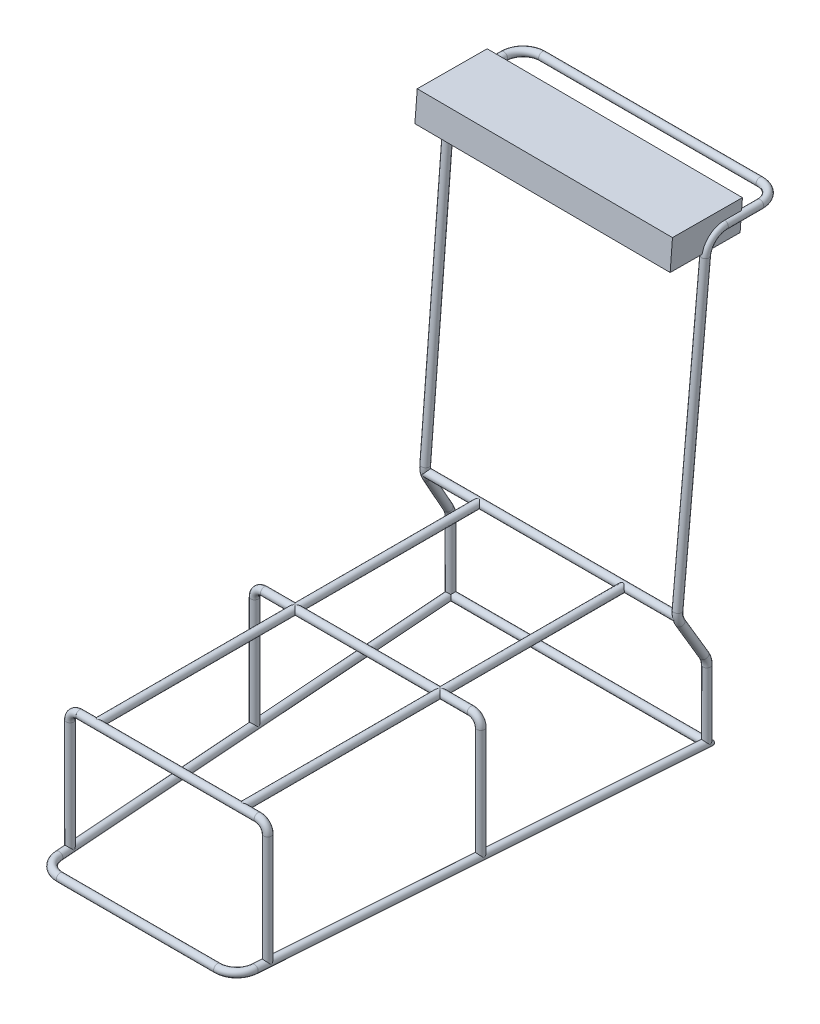
from build123d import *

# Parameters (mm, degrees)
SKETCH1_R                              = 7.9
SKETCH1_R_2                            = 6.7
PIPE_CONFIGURED_21_3_X_2_3_1_DEPTH     = 325.510463728
SKETCH1_ON_SEGMENT_2_R                 = 7.9
SKETCH1_ON_SEGMENT_2_R_2               = 6.7
PIPE_CONFIGURED_21_3_X_2_3_1_2_ANGLE   = 85.91438322
SKETCH1_ON_SEGMENT_3_R                 = 7.9
SKETCH1_ON_SEGMENT_3_R_2               = 6.7
PIPE_CONFIGURED_21_3_X_2_3_1_3_DEPTH   = 888.072479084
SKETCH1_ON_SEGMENT_4_R                 = 7.9
SKETCH1_ON_SEGMENT_4_R_2               = 6.7
PIPE_CONFIGURED_21_3_X_2_3_1_4_DEPTH   = 555.99754425
SKETCH1_ON_SEGMENT_5_R                 = 7.9
SKETCH1_ON_SEGMENT_5_R_2               = 6.7
PIPE_CONFIGURED_21_3_X_2_3_1_5_DEPTH   = 888.072479084
SKETCH1_ON_SEGMENT_6_R                 = 7.9
SKETCH1_ON_SEGMENT_6_R_2               = 6.7
PIPE_CONFIGURED_21_3_X_2_3_1_6_ANGLE   = 85.91438322
SKETCH13_R                             = 7.9
SKETCH13_R_2                           = 6.7
PIPE_CONFIGURED_21_3_X_2_3_5_DEPTH     = 139.269057496
SKETCH13_ON_SEGMENT_2_R                = 7.9
SKETCH13_ON_SEGMENT_2_R_2              = 6.7
PIPE_CONFIGURED_21_3_X_2_3_5_2_ANGLE   = 30
SKETCH13_ON_SEGMENT_3_R                = 7.9
SKETCH13_ON_SEGMENT_3_R_2              = 6.7
PIPE_CONFIGURED_21_3_X_2_3_5_3_DEPTH   = 92.155116602
SKETCH13_ON_SEGMENT_4_R                = 7.9
SKETCH13_ON_SEGMENT_4_R_2              = 6.7
PIPE_CONFIGURED_21_3_X_2_3_5_4_ANGLE   = 35
SKETCH13_ON_SEGMENT_5_R                = 7.9
SKETCH13_ON_SEGMENT_5_R_2              = 6.7
PIPE_CONFIGURED_21_3_X_2_3_5_5_DEPTH   = 613.247713082
SKETCH13_ON_SEGMENT_6_R                = 7.9
SKETCH13_ON_SEGMENT_6_R_2              = 6.7
PIPE_CONFIGURED_21_3_X_2_3_5_6_ANGLE   = 85.012738731
SKETCH13_ON_SEGMENT_7_R                = 7.9
SKETCH13_ON_SEGMENT_7_R_2              = 6.7
PIPE_CONFIGURED_21_3_X_2_3_5_7_DEPTH   = 73.338571858
SKETCH13_ON_SEGMENT_8_R                = 7.9
SKETCH13_ON_SEGMENT_8_R_2              = 6.7
PIPE_CONFIGURED_21_3_X_2_3_5_8_ANGLE   = 90
SKETCH13_ON_SEGMENT_9_R                = 7.9
SKETCH13_ON_SEGMENT_9_R_2              = 6.7
PIPE_CONFIGURED_21_3_X_2_3_5_9_DEPTH   = 450
SKETCH13_ON_SEGMENT_10_R               = 7.9
SKETCH13_ON_SEGMENT_10_R_2             = 6.7
PIPE_CONFIGURED_21_3_X_2_3_5_10_ANGLE  = 90
SKETCH13_ON_SEGMENT_11_R               = 7.9
SKETCH13_ON_SEGMENT_11_R_2             = 6.7
PIPE_CONFIGURED_21_3_X_2_3_5_11_DEPTH  = 73.338571858
SKETCH13_ON_SEGMENT_12_R               = 7.9
SKETCH13_ON_SEGMENT_12_R_2             = 6.7
PIPE_CONFIGURED_21_3_X_2_3_5_12_ANGLE  = 85.012738731
SKETCH13_ON_SEGMENT_13_R               = 7.9
SKETCH13_ON_SEGMENT_13_R_2             = 6.7
PIPE_CONFIGURED_21_3_X_2_3_5_13_DEPTH  = 613.247713082
SKETCH13_ON_SEGMENT_14_R               = 7.9
SKETCH13_ON_SEGMENT_14_R_2             = 6.7
PIPE_CONFIGURED_21_3_X_2_3_5_14_ANGLE  = 35
SKETCH13_ON_SEGMENT_15_R               = 7.9
SKETCH13_ON_SEGMENT_15_R_2             = 6.7
PIPE_CONFIGURED_21_3_X_2_3_5_15_DEPTH  = 92.155116602
SKETCH13_ON_SEGMENT_16_R               = 7.9
SKETCH13_ON_SEGMENT_16_R_2             = 6.7
PIPE_CONFIGURED_21_3_X_2_3_5_16_ANGLE  = 30
SKETCH13_ON_SEGMENT_17_R               = 7.9
SKETCH13_ON_SEGMENT_17_R_2             = 6.7
PIPE_CONFIGURED_21_3_X_2_3_5_17_DEPTH  = 139.269057496
SKETCH114_ON_SEGMENT_1_R               = 7.9375
SKETCH114_ON_SEGMENT_1_R_2             = 6.4375
PIPE_CONFIGURED_21_3_X_2_3_44_DEPTH    = 230
SKETCH114_ON_SEGMENT_2_R               = 7.9375
SKETCH114_ON_SEGMENT_2_R_2             = 6.4375
PIPE_CONFIGURED_21_3_X_2_3_44_2_ANGLE  = 90
SKETCH114_ON_SEGMENT_3_R               = 7.9375
SKETCH114_ON_SEGMENT_3_R_2             = 6.4375
PIPE_CONFIGURED_21_3_X_2_3_44_3_DEPTH  = 368.892991925
SKETCH114_ON_SEGMENT_4_R               = 7.9375
SKETCH114_ON_SEGMENT_4_R_2             = 6.4375
PIPE_CONFIGURED_21_3_X_2_3_44_4_ANGLE  = 90
SKETCH114_R                            = 7.9375
SKETCH114_R_2                          = 6.4375
PIPE_CONFIGURED_21_3_X_2_3_44_5_DEPTH  = 230
SKETCH119_R                            = 7.9375
SKETCH119_R_2                          = 6.4375
PIPE_CONFIGURED_21_3_X_2_3_75_DEPTH    = 230
SKETCH119_ON_SEGMENT_2_R               = 7.9375
SKETCH119_ON_SEGMENT_2_R_2             = 6.4375
PIPE_CONFIGURED_21_3_X_2_3_75_2_ANGLE  = 90
SKETCH119_ON_SEGMENT_3_R               = 7.9375
SKETCH119_ON_SEGMENT_3_R_2             = 6.4375
PIPE_CONFIGURED_21_3_X_2_3_75_3_DEPTH  = 427.653579857
SKETCH119_ON_SEGMENT_4_R               = 7.9375
SKETCH119_ON_SEGMENT_4_R_2             = 6.4375
PIPE_CONFIGURED_21_3_X_2_3_75_4_ANGLE  = 90
SKETCH119_ON_SEGMENT_5_R               = 7.9375
SKETCH119_ON_SEGMENT_5_R_2             = 6.4375
PIPE_CONFIGURED_21_3_X_2_3_75_5_DEPTH  = 230
SKETCH120_R                            = 7.9375
SKETCH120_R_2                          = 6.4375
PIPE_CONFIGURED_21_3_X_2_3_103_DEPTH   = 411.324115525
SKETCH120_ON_SEGMENT_2_R               = 7.9375
SKETCH120_ON_SEGMENT_2_R_2             = 6.4375
PIPE_CONFIGURED_21_3_X_2_3_103_2_DEPTH = 411.324115525
SKETCH121_R                            = 7.9375
SKETCH121_R_2                          = 6.4375
PIPE_CONFIGURED_21_3_X_2_3_104_DEPTH   = 380.745603313
SKETCH121_ON_SEGMENT_2_R               = 7.9375
SKETCH121_ON_SEGMENT_2_R_2             = 6.4375
PIPE_CONFIGURED_21_3_X_2_3_104_2_DEPTH = 380.987988156
SKETCH122_R                            = 7.9375
SKETCH122_R_2                          = 6.4375
PIPE_CONFIGURED_21_3_X_2_3_105_DEPTH   = 522.049063143


with BuildPart() as part:
    # Sketch1 → Pipe - configured 21.3 X 2.3(1) (new body)
    with BuildSketch(Plane(origin=(-162.755231864, 0, 0), x_dir=(0, 0, -1), z_dir=(1, 0, 0))):
        Circle(SKETCH1_R)
        Circle(SKETCH1_R_2, mode=Mode.SUBTRACT)
    extrude(amount=PIPE_CONFIGURED_21_3_X_2_3_1_DEPTH)


with BuildPart() as body_2:
    # Sketch1 on segment 2 (carried to the start of arc 2) → Pipe - configured 21.3 X 2.3_1 2 (revolve)
    with BuildSketch(Plane(origin=(162.755231864, 0, 0), x_dir=(0, 0, -1), z_dir=(1, 0, 0))):
        Circle(SKETCH1_ON_SEGMENT_2_R)
        Circle(SKETCH1_ON_SEGMENT_2_R_2, mode=Mode.SUBTRACT)
    revolve(axis=Axis((162.755231864, 0, -40), (0, 1, 0)), revolution_arc=PIPE_CONFIGURED_21_3_X_2_3_1_2_ANGLE)


with BuildPart() as body_3:
    # Sketch1 on segment 3 (carried to segment 3) → Pipe - configured 21.3 X 2.3_1 3 (new body)
    with BuildSketch(Plane(origin=(265.926124167, 0, -922.965738343), x_dir=(0.9974587, 0, 0.07124705), z_dir=(-0.07124705, 0, 0.9974587))):
        Circle(SKETCH1_ON_SEGMENT_3_R)
        Circle(SKETCH1_ON_SEGMENT_3_R_2, mode=Mode.SUBTRACT)
    extrude(amount=PIPE_CONFIGURED_21_3_X_2_3_1_3_DEPTH)

    # Pipe - configured 21.3 X 2.3_1 3 mitre 1
    split(bisect_by=Plane(origin=(265, 0, -910), x_dir=(0, 1, 0), z_dir=(0.681451741, 0, 0.731863051)), keep=Keep.TOP)


with BuildPart() as body_4:
    # Sketch1 on segment 4 (carried to segment 4) → Pipe - configured 21.3 X 2.3_1 4 (new body)
    with BuildSketch(Plane(origin=(-277.998772125, 0, -910), x_dir=(0, 0, -1), z_dir=(1, 0, 0))):
        Circle(SKETCH1_ON_SEGMENT_4_R)
        Circle(SKETCH1_ON_SEGMENT_4_R_2, mode=Mode.SUBTRACT)
    extrude(amount=PIPE_CONFIGURED_21_3_X_2_3_1_4_DEPTH)

    # Pipe - configured 21.3 X 2.3_1 4 mitre 1
    split(bisect_by=Plane(origin=(265, 0, -910), x_dir=(0, -1, 0), z_dir=(-0.681451741, 0, -0.731863051)), keep=Keep.TOP)

    # Pipe - configured 21.3 X 2.3_1 4 mitre 2
    split(bisect_by=Plane(origin=(-265, 0, -910), x_dir=(0, 1, 0), z_dir=(0.681451741, 0, -0.731863051)), keep=Keep.TOP)


with BuildPart() as body_5:
    # Sketch1 on segment 5 (carried to segment 5) → Pipe - configured 21.3 X 2.3_1 5 (new body)
    with BuildSketch(Plane(origin=(-265.926124167, 0, -922.965738343), x_dir=(0.9974587, 0, -0.07124705), z_dir=(0.07124705, 0, 0.9974587))):
        Circle(SKETCH1_ON_SEGMENT_5_R)
        Circle(SKETCH1_ON_SEGMENT_5_R_2, mode=Mode.SUBTRACT)
    extrude(amount=PIPE_CONFIGURED_21_3_X_2_3_1_5_DEPTH)

    # Pipe - configured 21.3 X 2.3_1 5 mitre 1
    split(bisect_by=Plane(origin=(-265, 0, -910), x_dir=(0, -1, 0), z_dir=(-0.681451741, 0, 0.731863051)), keep=Keep.TOP)


with BuildPart() as body_6:
    # Sketch1 on segment 6 (carried to the start of arc 6) → Pipe - configured 21.3 X 2.3_1 6 (revolve)
    with BuildSketch(Plane.ZY.offset(162.755231864)):
        Circle(SKETCH1_ON_SEGMENT_6_R)
        Circle(SKETCH1_ON_SEGMENT_6_R_2, mode=Mode.SUBTRACT)
    revolve(axis=Axis((-162.755231864, 0, -40), (0, -1, 0)), revolution_arc=PIPE_CONFIGURED_21_3_X_2_3_1_6_ANGLE)


with BuildPart() as body_7:
    # Sketch13 → Pipe - configured 21.3 X 2.3(5) (new body)
    with BuildSketch(Plane(origin=(265, 0, -910), x_dir=(1, 0, 0), z_dir=(0, 1, 0))):
        Circle(SKETCH13_R)
        Circle(SKETCH13_R_2, mode=Mode.SUBTRACT)
    extrude(amount=PIPE_CONFIGURED_21_3_X_2_3_5_DEPTH)


with BuildPart() as body_8:
    # Sketch13 on segment 2 (carried to the start of arc 2) → Pipe - configured 21.3 X 2.3_5 2 (revolve)
    with BuildSketch(Plane(origin=(265, 139.269057496, -910), x_dir=(1, 0, 0), z_dir=(0, 1, 0))):
        Circle(SKETCH13_ON_SEGMENT_2_R)
        Circle(SKETCH13_ON_SEGMENT_2_R_2, mode=Mode.SUBTRACT)
    revolve(axis=Axis((262.150118, 139.269057496, -870.101652007), (0.9974587, 0, 0.07124705)), revolution_arc=PIPE_CONFIGURED_21_3_X_2_3_5_2_ANGLE)


with BuildPart() as body_9:
    # Sketch13 on segment 3 (carried to segment 3) → Pipe - configured 21.3 X 2.3_5 3 (new body)
    with BuildSketch(Plane(origin=(264.61818821, 159.269057496, -904.654634938), x_dir=(0.999319926, 0.035623525, 0.009521037), z_dir=(-0.035623525, 0.866025404, 0.49872935))):
        Circle(SKETCH13_ON_SEGMENT_3_R)
        Circle(SKETCH13_ON_SEGMENT_3_R_2, mode=Mode.SUBTRACT)
    extrude(amount=PIPE_CONFIGURED_21_3_X_2_3_5_3_DEPTH)


with BuildPart() as body_10:
    # Sketch13 on segment 4 (carried to the start of arc 4) → Pipe - configured 21.3 X 2.3_5 4 (revolve)
    with BuildSketch(Plane(origin=(261.33529811, 239.077729562, -858.694173544), x_dir=(0.999319926, 0.035623525, 0.009521037), z_dir=(-0.035623525, 0.866025404, 0.49872935))):
        Circle(SKETCH13_ON_SEGMENT_4_R)
        Circle(SKETCH13_ON_SEGMENT_4_R_2, mode=Mode.SUBTRACT)
    revolve(axis=Axis((263.80336832, 259.077729562, -893.247156475), (-0.9974587, 0, -0.07124705)), revolution_arc=PIPE_CONFIGURED_21_3_X_2_3_5_4_ANGLE)


with BuildPart() as body_11:
    # Sketch13 on segment 5 (carried to segment 5) → Pipe - configured 21.3 X 2.3_5 5 (new body)
    with BuildSketch(Plane(origin=(260.964330982, 262.563959272, -853.500633741), x_dir=(0.999980684, -0.00620959, 0.000270428), z_dir=(0.00620959, 0.996194698, -0.086934254))):
        Circle(SKETCH13_ON_SEGMENT_5_R)
        Circle(SKETCH13_ON_SEGMENT_5_R_2, mode=Mode.SUBTRACT)
    extrude(amount=PIPE_CONFIGURED_21_3_X_2_3_5_5_DEPTH)


with BuildPart() as body_12:
    # Sketch13 on segment 6 (carried to the start of arc 6) → Pipe - configured 21.3 X 2.3_5 6 (revolve)
    with BuildSketch(Plane(origin=(264.772347579, 873.478079661, -906.8128661), x_dir=(0.999980684, -0.00620959, 0.000270428), z_dir=(0.00620959, 0.996194698, -0.086934254))):
        Circle(SKETCH13_ON_SEGMENT_6_R)
        Circle(SKETCH13_ON_SEGMENT_6_R_2, mode=Mode.SUBTRACT)
    revolve(axis=Axis((264.750672476, 870.00077706, -946.661428142), (-0.999980573, 0.006233188, 0)), revolution_arc=PIPE_CONFIGURED_21_3_X_2_3_5_6_ANGLE)


with BuildPart() as body_13:
    # Sketch13 on segment 7 (carried to segment 7) → Pipe - configured 21.3 X 2.3_5 7 (new body)
    with BuildSketch(Plane(origin=(265, 910, -946.661428142), x_dir=(1, 0, 0), z_dir=(0, 0, -1))):
        Circle(SKETCH13_ON_SEGMENT_7_R)
        Circle(SKETCH13_ON_SEGMENT_7_R_2, mode=Mode.SUBTRACT)
    extrude(amount=PIPE_CONFIGURED_21_3_X_2_3_5_7_DEPTH)


with BuildPart() as body_14:
    # Sketch13 on segment 8 (carried to the start of arc 8) → Pipe - configured 21.3 X 2.3_5 8 (revolve)
    with BuildSketch(Plane(origin=(265, 910, -1020), x_dir=(1, 0, 0), z_dir=(0, 0, -1))):
        Circle(SKETCH13_ON_SEGMENT_8_R)
        Circle(SKETCH13_ON_SEGMENT_8_R_2, mode=Mode.SUBTRACT)
    revolve(axis=Axis((225, 910, -1020), (0, 1, 0)), revolution_arc=PIPE_CONFIGURED_21_3_X_2_3_5_8_ANGLE)


with BuildPart() as body_15:
    # Sketch13 on segment 9 (carried to segment 9) → Pipe - configured 21.3 X 2.3_5 9 (new body)
    with BuildSketch(Plane(origin=(-225, 910, -1060), x_dir=(0, -1, 0), z_dir=(1, 0, 0))):
        Circle(SKETCH13_ON_SEGMENT_9_R)
        Circle(SKETCH13_ON_SEGMENT_9_R_2, mode=Mode.SUBTRACT)
    extrude(amount=PIPE_CONFIGURED_21_3_X_2_3_5_9_DEPTH)


with BuildPart() as body_16:
    # Sketch13 on segment 10 (carried to the start of arc 10) → Pipe - configured 21.3 X 2.3_5 10 (revolve)
    with BuildSketch(Plane(origin=(-265, 910, -1020), x_dir=(1, 0, 0), z_dir=(0, 0, -1))):
        Circle(SKETCH13_ON_SEGMENT_10_R)
        Circle(SKETCH13_ON_SEGMENT_10_R_2, mode=Mode.SUBTRACT)
    revolve(axis=Axis((-225, 910, -1020), (0, -1, 0)), revolution_arc=PIPE_CONFIGURED_21_3_X_2_3_5_10_ANGLE)


with BuildPart() as body_17:
    # Sketch13 on segment 11 (carried to segment 11) → Pipe - configured 21.3 X 2.3_5 11 (new body)
    with BuildSketch(Plane(origin=(-265, 910, -946.661428142), x_dir=(1, 0, 0), z_dir=(0, 0, -1))):
        Circle(SKETCH13_ON_SEGMENT_11_R)
        Circle(SKETCH13_ON_SEGMENT_11_R_2, mode=Mode.SUBTRACT)
    extrude(amount=PIPE_CONFIGURED_21_3_X_2_3_5_11_DEPTH)


with BuildPart() as body_18:
    # Sketch13 on segment 12 (carried to the start of arc 12) → Pipe - configured 21.3 X 2.3_5 12 (revolve)
    with BuildSketch(Plane(origin=(-264.772347579, 873.478079661, -906.8128661), x_dir=(0.999980684, 0.00620959, -0.000270428), z_dir=(-0.00620959, 0.996194698, -0.086934254))):
        Circle(SKETCH13_ON_SEGMENT_12_R)
        Circle(SKETCH13_ON_SEGMENT_12_R_2, mode=Mode.SUBTRACT)
    revolve(axis=Axis((-264.750672476, 870.00077706, -946.661428142), (-0.999980573, -0.006233188, 0)), revolution_arc=PIPE_CONFIGURED_21_3_X_2_3_5_12_ANGLE)


with BuildPart() as body_19:
    # Sketch13 on segment 13 (carried to segment 13) → Pipe - configured 21.3 X 2.3_5 13 (new body)
    with BuildSketch(Plane(origin=(-260.964330982, 262.563959272, -853.500633741), x_dir=(0.999980684, 0.00620959, -0.000270428), z_dir=(-0.00620959, 0.996194698, -0.086934254))):
        Circle(SKETCH13_ON_SEGMENT_13_R)
        Circle(SKETCH13_ON_SEGMENT_13_R_2, mode=Mode.SUBTRACT)
    extrude(amount=PIPE_CONFIGURED_21_3_X_2_3_5_13_DEPTH)


with BuildPart() as body_20:
    # Sketch13 on segment 14 (carried to the start of arc 14) → Pipe - configured 21.3 X 2.3_5 14 (revolve)
    with BuildSketch(Plane(origin=(-261.33529811, 239.077729562, -858.694173544), x_dir=(0.999319926, -0.035623525, -0.009521037), z_dir=(0.035623525, 0.866025404, 0.49872935))):
        Circle(SKETCH13_ON_SEGMENT_14_R)
        Circle(SKETCH13_ON_SEGMENT_14_R_2, mode=Mode.SUBTRACT)
    revolve(axis=Axis((-263.80336832, 259.077729562, -893.247156475), (-0.9974587, 0, 0.07124705)), revolution_arc=PIPE_CONFIGURED_21_3_X_2_3_5_14_ANGLE)


with BuildPart() as body_21:
    # Sketch13 on segment 15 (carried to segment 15) → Pipe - configured 21.3 X 2.3_5 15 (new body)
    with BuildSketch(Plane(origin=(-264.61818821, 159.269057496, -904.654634938), x_dir=(0.999319926, -0.035623525, -0.009521037), z_dir=(0.035623525, 0.866025404, 0.49872935))):
        Circle(SKETCH13_ON_SEGMENT_15_R)
        Circle(SKETCH13_ON_SEGMENT_15_R_2, mode=Mode.SUBTRACT)
    extrude(amount=PIPE_CONFIGURED_21_3_X_2_3_5_15_DEPTH)


with BuildPart() as body_22:
    # Sketch13 on segment 16 (carried to the start of arc 16) → Pipe - configured 21.3 X 2.3_5 16 (revolve)
    with BuildSketch(Plane(origin=(-265, 139.269057496, -910), x_dir=(1, 0, 0), z_dir=(0, 1, 0))):
        Circle(SKETCH13_ON_SEGMENT_16_R)
        Circle(SKETCH13_ON_SEGMENT_16_R_2, mode=Mode.SUBTRACT)
    revolve(axis=Axis((-262.150118, 139.269057496, -870.101652007), (0.9974587, 0, -0.07124705)), revolution_arc=PIPE_CONFIGURED_21_3_X_2_3_5_16_ANGLE)


with BuildPart() as body_23:
    # Sketch13 on segment 17 (carried to segment 17) → Pipe - configured 21.3 X 2.3_5 17 (new body)
    with BuildSketch(Plane(origin=(-265, 0, -910), x_dir=(1, 0, 0), z_dir=(0, 1, 0))):
        Circle(SKETCH13_ON_SEGMENT_17_R)
        Circle(SKETCH13_ON_SEGMENT_17_R_2, mode=Mode.SUBTRACT)
    extrude(amount=PIPE_CONFIGURED_21_3_X_2_3_5_17_DEPTH)


with BuildPart() as body_24:
    # Ressalto-extrusão2: read off the stored shape, not the designer's step
    # Ressalto-extrusão2: loft between two sections, ruled curve by curve
    ressalto_extrus_o2_from = [
        Edge.make_line((265.186287687, 880.114159057, -834.061258314), (265.908890984, 880.114159057, -978.059445262)),
        Edge.make_line((-265.536315611, 880.114159057, -836.724499507), (265.186287687, 880.114159057, -834.061258314)),
        Edge.make_line((-264.813712313, 880.114159057, -980.722686456), (-265.536315611, 880.114159057, -836.724499507)),
        Edge.make_line((265.908890984, 880.114159057, -978.059445262), (-264.813712313, 880.114159057, -980.722686456)),
    ]
    ressalto_extrus_o2_to = [
        Edge.make_line((264.813712313, 939.885840943, -839.277313544), (265.536315611, 939.885840943, -983.275500493)),
        Edge.make_line((-265.908890984, 939.885840943, -841.940554738), (264.813712313, 939.885840943, -839.277313544)),
        Edge.make_line((-265.186287687, 939.885840943, -985.938741686), (-265.908890984, 939.885840943, -841.940554738)),
        Edge.make_line((265.536315611, 939.885840943, -983.275500493), (-265.186287687, 939.885840943, -985.938741686)),
    ]
    ressalto_extrus_o2 = Solid(Shell([*[Face.make_surface_from_curves(ressalto_extrus_o2_from[k], ressalto_extrus_o2_to[k]) for k in range(4)], Face(Wire(ressalto_extrus_o2_from)), Face(Wire(ressalto_extrus_o2_to))]))
    add(ressalto_extrus_o2)


with BuildPart() as body_25:
    # Sketch114 on segment 1 (carried to segment 1) → Pipe - configured 21.3 X 2.3(44) (new body)
    with BuildSketch(Plane(origin=(-204.446495963, 230, -62.250943476), x_dir=(1, 0, 0), z_dir=(0, -1, 0))):
        Circle(SKETCH114_ON_SEGMENT_1_R)
        Circle(SKETCH114_ON_SEGMENT_1_R_2, mode=Mode.SUBTRACT)
    extrude(amount=PIPE_CONFIGURED_21_3_X_2_3_44_DEPTH)


with BuildPart() as body_26:
    # Sketch114 on segment 2 (carried to the start of arc 2) → Pipe - configured 21.3 X 2.3_44 2 (revolve)
    with BuildSketch(Plane(origin=(-184.446495963, 250, -62.250943476), x_dir=(0, -1, 0), z_dir=(-1, 0, 0))):
        Circle(SKETCH114_ON_SEGMENT_2_R)
        Circle(SKETCH114_ON_SEGMENT_2_R_2, mode=Mode.SUBTRACT)
    revolve(axis=Axis((-184.446495963, 230, -62.250943476), (0, 0, 1)), revolution_arc=PIPE_CONFIGURED_21_3_X_2_3_44_2_ANGLE)


with BuildPart() as body_27:
    # Sketch114 on segment 3 (carried to segment 3) → Pipe - configured 21.3 X 2.3_44 3 (new body)
    with BuildSketch(Plane(origin=(-184.446495963, 250, -62.250943476), x_dir=(0, 1, 0), z_dir=(1, 0, 0))):
        Circle(SKETCH114_ON_SEGMENT_3_R)
        Circle(SKETCH114_ON_SEGMENT_3_R_2, mode=Mode.SUBTRACT)
    extrude(amount=PIPE_CONFIGURED_21_3_X_2_3_44_3_DEPTH)


with BuildPart() as body_28:
    # Sketch114 on segment 4 (carried to the start of arc 4) → Pipe - configured 21.3 X 2.3_44 4 (revolve)
    with BuildSketch(Plane(origin=(204.446495963, 230, -62.250943476), x_dir=(-1, 0, 0), z_dir=(0, 1, 0))):
        Circle(SKETCH114_ON_SEGMENT_4_R)
        Circle(SKETCH114_ON_SEGMENT_4_R_2, mode=Mode.SUBTRACT)
    revolve(axis=Axis((184.446495963, 230, -62.250943476), (0, 0, 1)), revolution_arc=PIPE_CONFIGURED_21_3_X_2_3_44_4_ANGLE)


with BuildPart() as body_29:
    # Sketch114 → Pipe - configured 21.3 X 2.3_44 5 (new body)
    with BuildSketch(Plane(origin=(204.446495963, 230, -62.250943476), x_dir=(1, 0, 0), z_dir=(0, -1, 0))):
        Circle(SKETCH114_R)
        Circle(SKETCH114_R_2, mode=Mode.SUBTRACT)
    extrude(amount=PIPE_CONFIGURED_21_3_X_2_3_44_5_DEPTH)


with BuildPart() as body_30:
    # Sketch119 → Pipe - configured 21.3 X 2.3(75) (new body)
    with BuildSketch(Plane(origin=(233.826789929, 0, -473.575059), x_dir=(1, 0, 0), z_dir=(0, 1, 0))):
        Circle(SKETCH119_R)
        Circle(SKETCH119_R_2, mode=Mode.SUBTRACT)
    extrude(amount=PIPE_CONFIGURED_21_3_X_2_3_75_DEPTH)


with BuildPart() as body_31:
    # Sketch119 on segment 2 (carried to the start of arc 2) → Pipe - configured 21.3 X 2.3_75 2 (revolve)
    with BuildSketch(Plane(origin=(213.826789929, 250, -473.575059), x_dir=(0, -1, 0), z_dir=(1, 0, 0))):
        Circle(SKETCH119_ON_SEGMENT_2_R)
        Circle(SKETCH119_ON_SEGMENT_2_R_2, mode=Mode.SUBTRACT)
    revolve(axis=Axis((213.826789929, 230, -473.575059), (0, 0, -1)), revolution_arc=PIPE_CONFIGURED_21_3_X_2_3_75_2_ANGLE)


with BuildPart() as body_32:
    # Sketch119 on segment 3 (carried to segment 3) → Pipe - configured 21.3 X 2.3_75 3 (new body)
    with BuildSketch(Plane(origin=(-213.826789929, 250, -473.575059), x_dir=(0, -1, 0), z_dir=(1, 0, 0))):
        Circle(SKETCH119_ON_SEGMENT_3_R)
        Circle(SKETCH119_ON_SEGMENT_3_R_2, mode=Mode.SUBTRACT)
    extrude(amount=PIPE_CONFIGURED_21_3_X_2_3_75_3_DEPTH)


with BuildPart() as body_33:
    # Sketch119 on segment 4 (carried to the start of arc 4) → Pipe - configured 21.3 X 2.3_75 4 (revolve)
    with BuildSketch(Plane(origin=(-233.826789929, 230, -473.575059), x_dir=(1, 0, 0), z_dir=(0, 1, 0))):
        Circle(SKETCH119_ON_SEGMENT_4_R)
        Circle(SKETCH119_ON_SEGMENT_4_R_2, mode=Mode.SUBTRACT)
    revolve(axis=Axis((-213.826789929, 230, -473.575059), (0, 0, -1)), revolution_arc=PIPE_CONFIGURED_21_3_X_2_3_75_4_ANGLE)


with BuildPart() as body_34:
    # Sketch119 on segment 5 (carried to segment 5) → Pipe - configured 21.3 X 2.3_75 5 (new body)
    with BuildSketch(Plane(origin=(-233.826789929, 0, -473.575059), x_dir=(1, 0, 0), z_dir=(0, 1, 0))):
        Circle(SKETCH119_ON_SEGMENT_5_R)
        Circle(SKETCH119_ON_SEGMENT_5_R_2, mode=Mode.SUBTRACT)
    extrude(amount=PIPE_CONFIGURED_21_3_X_2_3_75_5_DEPTH)


with BuildPart() as body_35:
    # Sketch120 → Pipe - configured 21.3 X 2.3(103) (new body)
    with BuildSketch(Plane(origin=(-150, 250, -62.250943476), x_dir=(1, 0, 0), z_dir=(0, 0, -1))):
        Circle(SKETCH120_R)
        Circle(SKETCH120_R_2, mode=Mode.SUBTRACT)
    extrude(amount=PIPE_CONFIGURED_21_3_X_2_3_103_DEPTH)


with BuildPart() as body_36:
    # Sketch120 on segment 2 (carried to segment 2) → Pipe - configured 21.3 X 2.3_103 2 (new body)
    with BuildSketch(Plane(origin=(150, 250, -62.250943476), x_dir=(1, 0, 0), z_dir=(0, 0, -1))):
        Circle(SKETCH120_ON_SEGMENT_2_R)
        Circle(SKETCH120_ON_SEGMENT_2_R_2, mode=Mode.SUBTRACT)
    extrude(amount=PIPE_CONFIGURED_21_3_X_2_3_103_2_DEPTH)


with BuildPart() as body_37:
    # Sketch121 → Pipe - configured 21.3 X 2.3(104) (new body)
    with BuildSketch(Plane(origin=(150, 250, -473.575059), x_dir=(1, 0, 0), z_dir=(0, 0, -1))):
        Circle(SKETCH121_R)
        Circle(SKETCH121_R_2, mode=Mode.SUBTRACT)
    extrude(amount=PIPE_CONFIGURED_21_3_X_2_3_104_DEPTH)


with BuildPart() as body_38:
    # Sketch121 on segment 2 (carried to segment 2) → Pipe - configured 21.3 X 2.3_104 2 (new body)
    with BuildSketch(Plane(origin=(-149.999973385, 250.089355245, -473.381585088), x_dir=(1, 0, 0), z_dir=(0, 0, -1))):
        Circle(SKETCH121_ON_SEGMENT_2_R)
        Circle(SKETCH121_ON_SEGMENT_2_R_2, mode=Mode.SUBTRACT)
    extrude(amount=PIPE_CONFIGURED_21_3_X_2_3_104_2_DEPTH)


with BuildPart() as body_39:
    # Sketch122 → Pipe - configured 21.3 X 2.3(105) (new body)
    with BuildSketch(Plane(origin=(-261.02784548, 250, -854.389836714), x_dir=(0.00018315548042988864, -0.0008046527141637043, -0.9999996594939818), z_dir=(0.9999996594939818, 0.0008047998436766311, 0.00018250789583080927))):
        Circle(SKETCH122_R)
        Circle(SKETCH122_R_2, mode=Mode.SUBTRACT)
    extrude(amount=PIPE_CONFIGURED_21_3_X_2_3_105_DEPTH)


solid = Compound([part.part, body_2.part, body_3.part, body_4.part, body_5.part, body_6.part, body_7.part, body_8.part, body_9.part, body_10.part, body_11.part, body_12.part, body_13.part, body_14.part, body_15.part, body_16.part, body_17.part, body_18.part, body_19.part, body_20.part, body_21.part, body_22.part, body_23.part, body_24.part, body_25.part, body_26.part, body_27.part, body_28.part, body_29.part, body_30.part, body_31.part, body_32.part, body_33.part, body_34.part, body_35.part, body_36.part, body_37.part, body_38.part, body_39.part])
